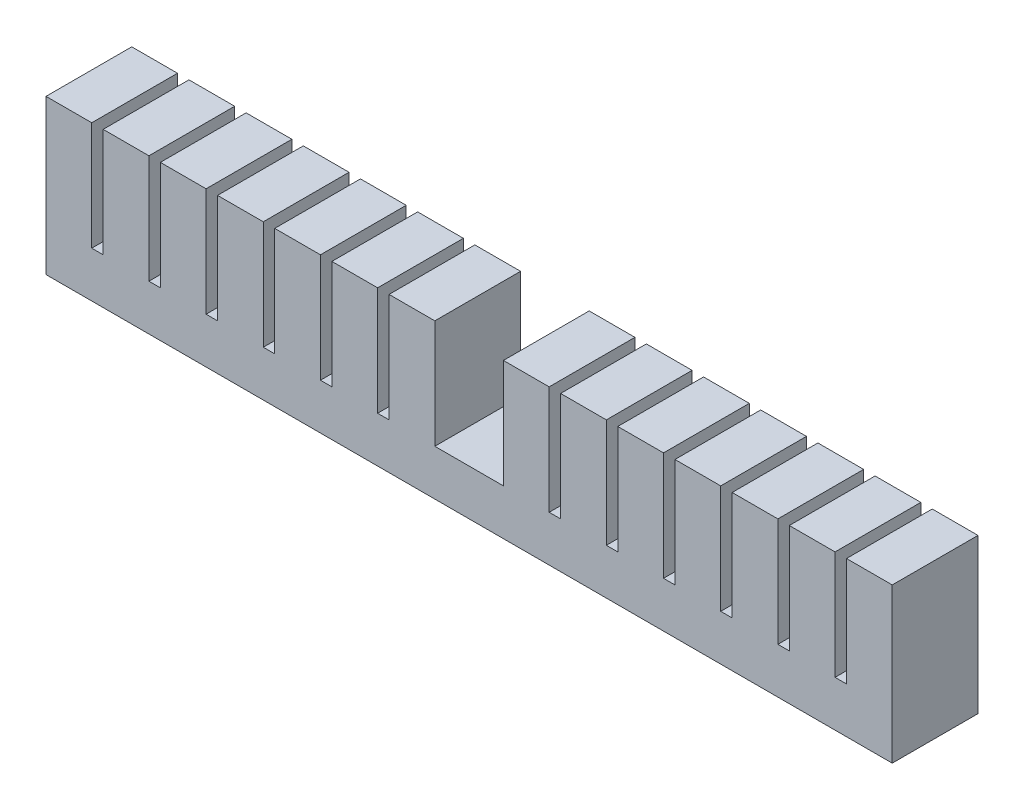
from build123d import *

# Parameters (mm, degrees)
BOSS_EXTRUDE1_DEPTH     = 7.5
LPATTERN1_COUNT         = 8
LPATTERN1_PITCH         = 10
LPATTERN1_COL_COUNT     = 8
LPATTERN1_COL_PITCH     = 10
SHELL2_T                = -2
CUT_EXTRUDE2_DEPTH      = 15
CUT_EXTRUDE2_DEPTH_BACK = 80.411900871
SKETCH3_W               = 1
SKETCH3_H               = 7
SKETCH4_W               = 11
SKETCH4_H               = 3
BOSS_EXTRUDE2_DEPTH     = 2
SKETCH5_W               = 11
SKETCH5_H               = 4
BOSS_EXTRUDE3_DEPTH     = 2
SKETCH6_W               = 148
SKETCH6_H               = 1
BOSS_EXTRUDE4_DEPTH     = 7.5
SKETCH8_W               = 8
SKETCH8_H               = 15
BOSS_EXTRUDE5_DEPTH     = 1
LPATTERN2_COUNT         = 15
LPATTERN2_PITCH         = 10
SKETCH10_W              = 8
SKETCH10_H              = 15
CUT_EXTRUDE4_DEPTH      = 21
SKETCH11_W              = 15
SKETCH11_H              = 2
BOSS_EXTRUDE6_DEPTH     = 8


# Read off the part's stored shape, not the designer's step: Split1
with BuildPart() as part:
    # Sketch1 → Boss-Extrude1 (new, symmetric)
    with BuildSketch(Plane.XY):
        Polygon((0, 0), (-5, 0), (-5, 7), (-4, 7), (-4, 25), (4, 25), (4, 7), (5, 7), (5, 0), align=None)
    boss_extrude1 = extrude(amount=BOSS_EXTRUDE1_DEPTH, both=True)

    # LPattern1: Boss-Extrude1 ×8
    with Locations(*[(-i * LPATTERN1_PITCH, 0, 0) for i in range(1, LPATTERN1_COUNT)]):
        add(boss_extrude1)


with BuildPart() as lpattern1_col_1:
    # LPattern1 col: pattern copy
    add(boss_extrude1.moved(Location(Vector(1, 0, 0) * (1 * LPATTERN1_COL_PITCH))))


with BuildPart() as lpattern1_col_2:
    # LPattern1 col: pattern copy
    add(boss_extrude1.moved(Location(Vector(1, 0, 0) * (2 * LPATTERN1_COL_PITCH))))


with BuildPart() as lpattern1_col_3:
    # LPattern1 col: pattern copy
    add(boss_extrude1.moved(Location(Vector(1, 0, 0) * (3 * LPATTERN1_COL_PITCH))))


with BuildPart() as lpattern1_col_4:
    # LPattern1 col: pattern copy
    add(boss_extrude1.moved(Location(Vector(1, 0, 0) * (4 * LPATTERN1_COL_PITCH))))


with BuildPart() as lpattern1_col_5:
    # LPattern1 col: pattern copy
    add(boss_extrude1.moved(Location(Vector(1, 0, 0) * (5 * LPATTERN1_COL_PITCH))))


with BuildPart() as lpattern1_col_6:
    # LPattern1 col: pattern copy
    add(boss_extrude1.moved(Location(Vector(1, 0, 0) * (6 * LPATTERN1_COL_PITCH))))


with BuildPart() as lpattern1_col_7:
    # LPattern1 col: pattern copy
    add(boss_extrude1.moved(Location(Vector(1, 0, 0) * (7 * LPATTERN1_COL_PITCH))))


with BuildPart() as part_1:
    add(part.part)

    # LPattern1 col united with what the copie: union LPattern1 col_1, LPattern1 col_2, LPattern1 col_3, LPattern1 col_4, LPattern1 col_5, LPattern1 col_6, LPattern1 col_7
    add(lpattern1_col_1.part)
    add(lpattern1_col_2.part)
    add(lpattern1_col_3.part)
    add(lpattern1_col_4.part)
    add(lpattern1_col_5.part)
    add(lpattern1_col_6.part)
    add(lpattern1_col_7.part)

    # Shell2
    shell2_openings = [part_1.faces().sort_by_distance(p)[0] for p in [
        (75, 3.5, 0),
        (-75, 3.5, 0),
    ]]
    offset(amount=SHELL2_T, openings=shell2_openings, kind=Kind.INTERSECTION)

    # Sketch3 → Cut-Extrude2 (cut, two sides: drawn at the far end of the back side and taken through both)
    with BuildSketch(Plane.XY.offset(-CUT_EXTRUDE2_DEPTH_BACK)):
        with Locations((-74.5, 3.5)):
            Rectangle(SKETCH3_W, SKETCH3_H)
        with Locations((74.5, 3.5)):
            Rectangle(SKETCH3_W, SKETCH3_H)
    extrude(amount=CUT_EXTRUDE2_DEPTH + CUT_EXTRUDE2_DEPTH_BACK, mode=Mode.SUBTRACT)

    # Sketch4 → Boss-Extrude2 (add)
    with BuildSketch(Plane.ZY.offset(74)):
        with Locations((0, 3.5)):
            Rectangle(SKETCH4_W, SKETCH4_H)
    extrude(amount=-BOSS_EXTRUDE2_DEPTH)

    # Sketch5 → Boss-Extrude3 (add)
    with BuildSketch(Plane(origin=(74, 0, 0), x_dir=(0, 0, -1), z_dir=(1, 0, 0))):
        with Locations((0, 3)):
            Rectangle(SKETCH5_W, SKETCH5_H)
    extrude(amount=-BOSS_EXTRUDE3_DEPTH)

    # Sketch6 → Boss-Extrude4 (add, symmetric)
    with BuildSketch(Plane.XY):
        with Locations((0, -0.5)):
            Rectangle(SKETCH6_W, SKETCH6_H)
    extrude(amount=BOSS_EXTRUDE4_DEPTH, both=True)

    # Sketch8 → Boss-Extrude5 (add)
    with BuildSketch(Plane(origin=(0, 25, 0), x_dir=(1, 0, 0), z_dir=(0, 1, 0))):
        with Locations((-70, 0)):
            Rectangle(SKETCH8_W, SKETCH8_H)
    boss_extrude5 = extrude(amount=BOSS_EXTRUDE5_DEPTH)

    # LPattern2: Boss-Extrude5 ×15
    with Locations(*[(i * LPATTERN2_PITCH, 0, 0) for i in range(1, LPATTERN2_COUNT)]):
        add(boss_extrude5)


with BuildPart() as body_2:
    # Split1: the piece on the far side of the plane
    add(part_1.part)
    split(bisect_by=Plane(origin=(0, 2, 0), x_dir=(1, 0, 0), z_dir=(0, 1, 0)), keep=Keep.BOTTOM)


with BuildPart() as part_2:
    add(part_1.part)

    # Split1
    split(bisect_by=Plane(origin=(0, 2, 0), x_dir=(1, 0, 0), z_dir=(0, 1, 0)), keep=Keep.TOP)

    # Sketch10 → Cut-Extrude4 (cut)
    with BuildSketch(Plane(origin=(0, 26, 0), x_dir=(1, 0, 0), z_dir=(0, 1, 0))):
        Rectangle(SKETCH10_W, SKETCH10_H)
    extrude(amount=-CUT_EXTRUDE4_DEPTH, mode=Mode.SUBTRACT)

    # Sketch11 → Boss-Extrude6 (add)
    with BuildSketch(Plane(origin=(-4, 0, 0), x_dir=(0, 0, -1), z_dir=(1, 0, 0))):
        with Locations((0, 6)):
            Rectangle(SKETCH11_W, SKETCH11_H)
    extrude(amount=BOSS_EXTRUDE6_DEPTH)


with BuildPart() as body_2_1:
    add(body_2.part)

    # Combine1: union part
    add(part_2.part)


solid = body_2_1.part
